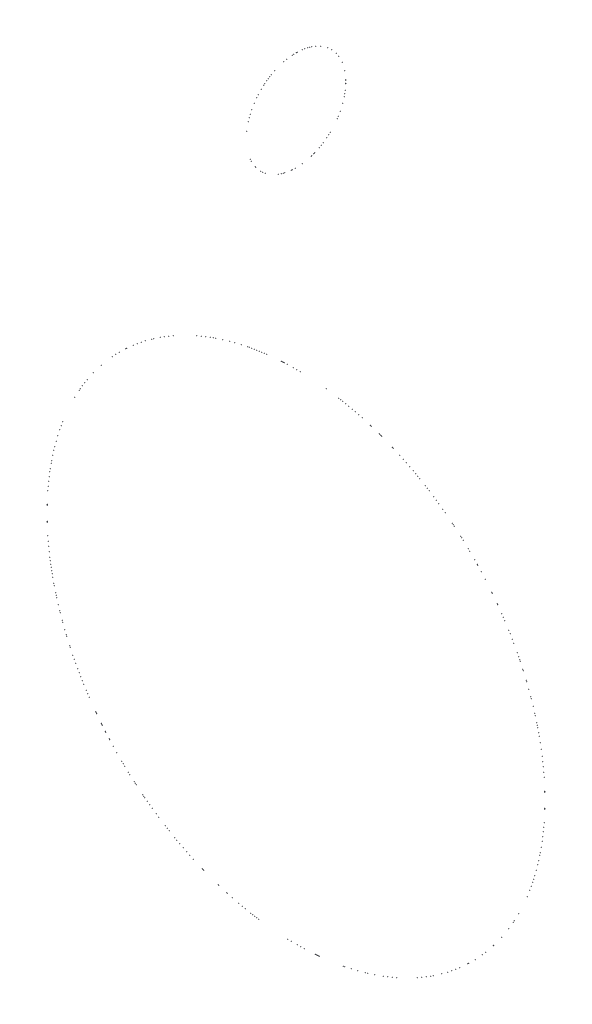
from build123d import *

# Parameters (mm, degrees)
SCHIZZO1_R                = 10.001
SCHIZZO1_R_2              = 10
ESTRUSIONE_SOTTILE1_DEPTH = 0.001
SCHIZZO2_R                = 2.001
SCHIZZO2_R_2              = 2
ESTRUSIONE_SOTTILE2_DEPTH = 0.001


with BuildPart() as part:
    # Schizzo1 → Estrusione-Sottile1 (new body)
    with BuildSketch(Plane.XY):
        Circle(SCHIZZO1_R)
        Circle(SCHIZZO1_R_2, mode=Mode.SUBTRACT)
    extrude(amount=ESTRUSIONE_SOTTILE1_DEPTH)


with BuildPart() as body_2:
    # Schizzo2 → Estrusione-Sottile2 (new body)
    with BuildSketch(Plane(origin=(0, 0, 0), x_dir=(0, 0, -1), z_dir=(1, 0, 0))):
        with Locations((0, 19)):
            Circle(SCHIZZO2_R)
        with Locations((0, 19)):
            Circle(SCHIZZO2_R_2, mode=Mode.SUBTRACT)
    extrude(amount=ESTRUSIONE_SOTTILE2_DEPTH)


solid = Compound([part.part, body_2.part])
